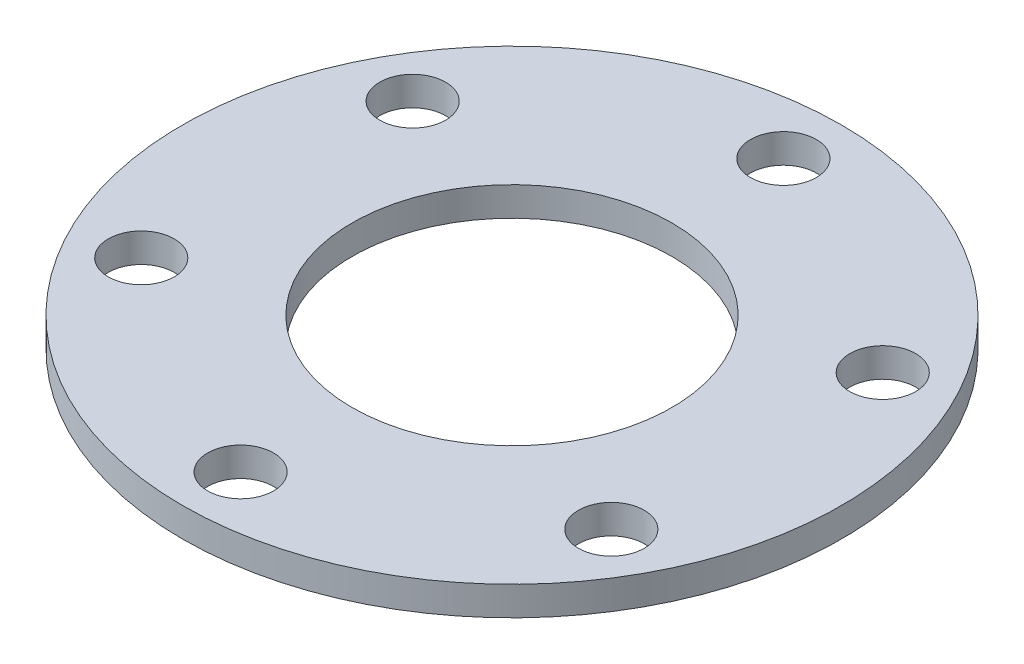
from build123d import *

# Parameters (mm, degrees)
SKETCH1_R           = 17
SKETCH1_R_2         = 8.25
SKETCH1_R_3         = 1.7
BOSS_EXTRUDE1_DEPTH = 1.5


with BuildPart() as part:
    # Sketch1 → Boss-Extrude1 (new body)
    with BuildSketch(Plane(origin=(0, 0, 0), x_dir=(1, 0, 0), z_dir=(0, 1, 0))):
        Circle(SKETCH1_R)
        Circle(SKETCH1_R_2, mode=Mode.SUBTRACT)
        with Locations((0, 14)):
            Circle(SKETCH1_R_3, mode=Mode.SUBTRACT)
        with Locations((12.124355653, 7)):
            Circle(SKETCH1_R_3, mode=Mode.SUBTRACT)
        with Locations((12.124355653, -7)):
            Circle(SKETCH1_R_3, mode=Mode.SUBTRACT)
        with Locations((0, -14)):
            Circle(SKETCH1_R_3, mode=Mode.SUBTRACT)
        with Locations((-12.124355653, -7)):
            Circle(SKETCH1_R_3, mode=Mode.SUBTRACT)
        with Locations((-12.124355653, 7)):
            Circle(SKETCH1_R_3, mode=Mode.SUBTRACT)
    extrude(amount=BOSS_EXTRUDE1_DEPTH)


solid = part.part
